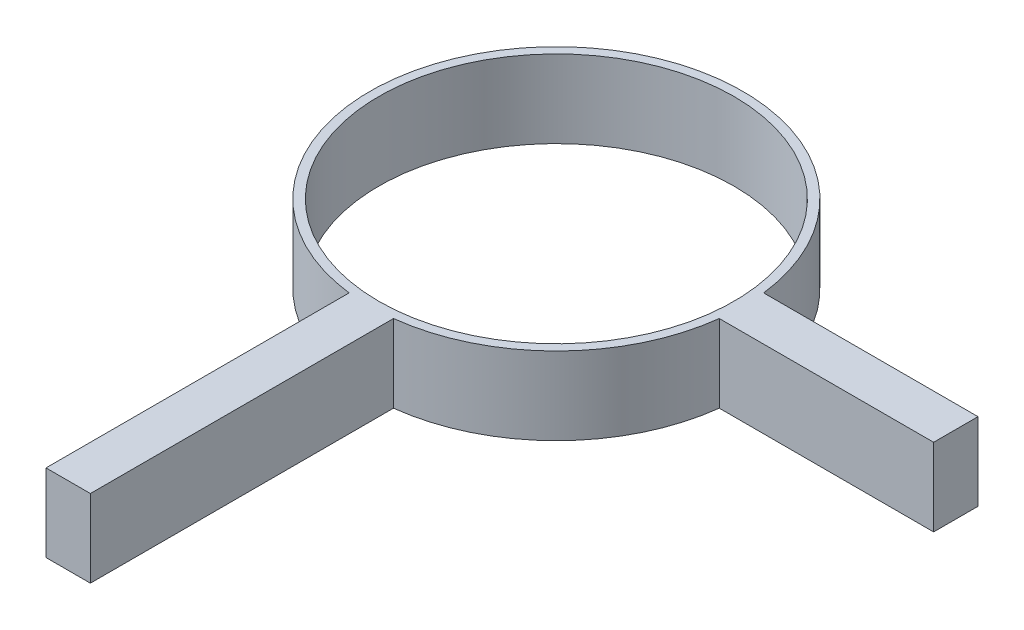
from build123d import *

# Parameters (mm, degrees)
SKETCH1_R           = 16
BOSS_EXTRUDE1_DEPTH = 7


with BuildPart() as part:
    # Sketch1 → Boss-Extrude1 (new body)
    with BuildSketch(Plane(origin=(0, 0, 0), x_dir=(1, 0, 0), z_dir=(0, 1, 0))):
        with BuildLine():
            Line((2, -44), (2, -16.68052757))
            ThreePointArc((2, -16.68052757), (11.879393924, -11.879393924), (16.68052757, -2))
            Line((16.68052757, -2), (36, -2))
            Line((36, -2), (36, 2))
            Line((36, 2), (16.68052757, 2))
            ThreePointArc((16.68052757, 2), (-11.879393924, 11.879393924), (-2, -16.68052757))
            Line((-2, -16.68052757), (-2, -44))
            Line((-2, -44), (2, -44))
        make_face()
        Circle(SKETCH1_R, mode=Mode.SUBTRACT)
    extrude(amount=BOSS_EXTRUDE1_DEPTH)


solid = part.part
